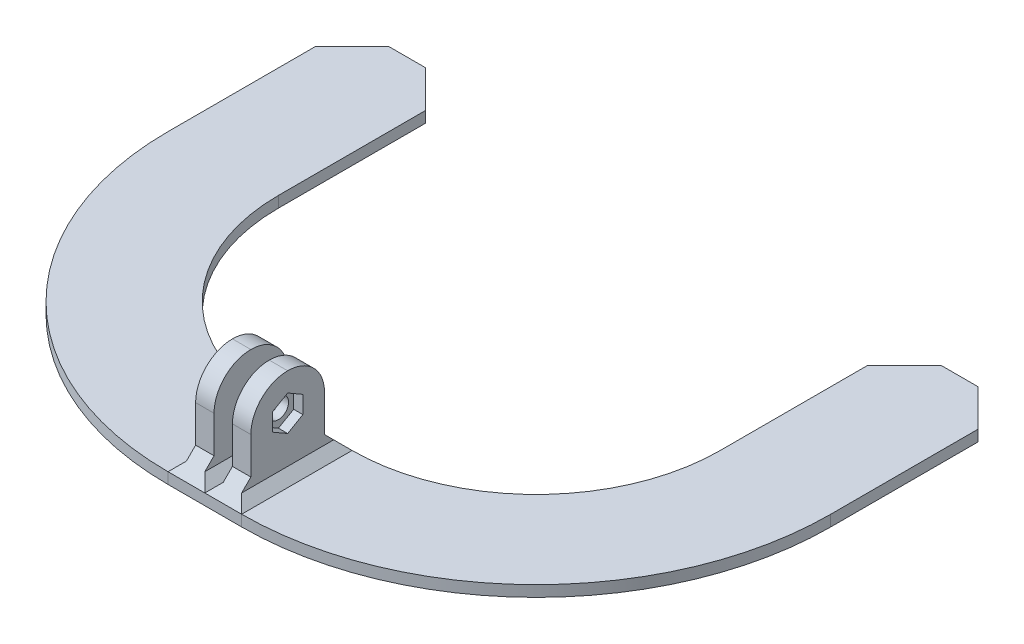
from build123d import *

# Parameters (mm, degrees)
BOSS_EXTRUDE1_DEPTH     = 3
SKETCH4_W               = 5
SKETCH4_H               = 20
BOSS_EXTRUDE2_DEPTH     = 25
FILLET3_R               = 10
CUT_EXTRUDE3_DEPTH      = 121.479251326
CUT_EXTRUDE3_DEPTH_BACK = 121.479251326
SKETCH5_R               = 2.75
CUT_EXTRUDE4_DEPTH      = 2.5
CHAMFER1_SIZE           = 5
CHAMFER3_SIZE           = 2.5
SKETCH7_W               = 30
SKETCH7_H               = 3
BOSS_EXTRUDE3_DEPTH     = 50
CHAMFER4_SIZE           = 10


with BuildPart() as part:
    # Sketch1 → Boss-Extrude1 (new body)
    with BuildSketch(Plane(origin=(0, 0, 0), x_dir=(1, 0, 0), z_dir=(0, 1, 0))):
        with BuildLine():
            Line((-10, 15), (10, 15))
            ThreePointArc((10, 15), (45.355339059, 29.644660941), (60, 65))
            Line((60, 65), (90, 65))
            ThreePointArc((90, 65), (66.568542495, 8.431457505), (10, -15))
            Line((10, -15), (-10, -15))
            ThreePointArc((-10, -15), (-66.568542495, 8.431457505), (-90, 65))
            Line((-90, 65), (-60, 65))
            ThreePointArc((-60, 65), (-45.355339059, 29.644660941), (-10, 15))
        make_face()
    extrude(amount=BOSS_EXTRUDE1_DEPTH)

    # Sketch4 → Boss-Extrude2 (add)
    with BuildSketch(Plane(origin=(0, 3, 0), x_dir=(1, 0, 0), z_dir=(0, 1, 0))):
        with Locations((-5, 0)):
            Rectangle(SKETCH4_W, SKETCH4_H)
        with Locations((5, 0)):
            Rectangle(SKETCH4_W, SKETCH4_H)
    extrude(amount=BOSS_EXTRUDE2_DEPTH)

    # Fillet3
    fillet3_edges = [part.edges().sort_by_distance(p)[0] for p in [
        (5, 28, 10),
        (5, 28, -10),
        (-5, 28, -10),
        (-5, 28, 10),
    ]]
    fillet(fillet3_edges, radius=FILLET3_R - 0.0001)  # a hair under: the kernel refuses the full size

    # Sketch5 → Cut-Extrude3 (cut, two sides: drawn at the far end of the back side and taken through both)
    with BuildSketch(Plane.ZY.offset(7.5).offset(-CUT_EXTRUDE3_DEPTH_BACK)):
        with Locations((0, 18)):
            Circle(SKETCH5_R)
    extrude(amount=CUT_EXTRUDE3_DEPTH + CUT_EXTRUDE3_DEPTH_BACK, mode=Mode.SUBTRACT)

    # Sketch6 → Cut-Extrude4 (cut)
    with BuildSketch(Plane(origin=(7.5, 0, 0), x_dir=(0, 0, -1), z_dir=(1, 0, 0))):
        Polygon((0, 13.236860279), (4.125, 15.61843014), (4.125, 20.38156986), (0, 22.763139721), (-4.125, 20.38156986), (-4.125, 15.61843014), align=None)
    extrude(amount=-CUT_EXTRUDE4_DEPTH, mode=Mode.SUBTRACT)

    # Chamfer1
    chamfer1_edges = [part.edges().sort_by_distance(p)[0] for p in [
        (-5, 3, -10),
        (-5, 3, 10),
        (5, 3, -10),
        (5, 3, 10),
    ]]
    chamfer(chamfer1_edges, length=CHAMFER1_SIZE - 0.0001)  # a hair under: the kernel refuses the full size

    # Chamfer3
    chamfer3_edges = [part.edges().sort_by_distance(p)[0] for p in [
        (-2.5, 3, 0),
        (-7.5, 3, 0),
        (2.5, 3, 0),
        (7.5, 3, 0),
    ]]
    chamfer(chamfer3_edges, length=CHAMFER3_SIZE - 0.0001)  # a hair under: the kernel refuses the full size

    # Sketch7 → Boss-Extrude3 (add)
    with BuildSketch(Plane(origin=(0, 0, -65), x_dir=(-1, 0, 0), z_dir=(0, 0, -1))):
        with Locations((-75, 1.5)):
            Rectangle(SKETCH7_W, SKETCH7_H)
        with Locations((75, 1.5)):
            Rectangle(SKETCH7_W, SKETCH7_H)
    extrude(amount=BOSS_EXTRUDE3_DEPTH)

    # Chamfer4
    chamfer4_edges = [part.edges().sort_by_distance(p)[0] for p in [
        (90, 1.5, -115),
        (60, 1.5, -115),
        (-60, 1.5, -115),
        (-90, 1.5, -115),
    ]]
    chamfer(chamfer4_edges, length=CHAMFER4_SIZE)


solid = part.part
